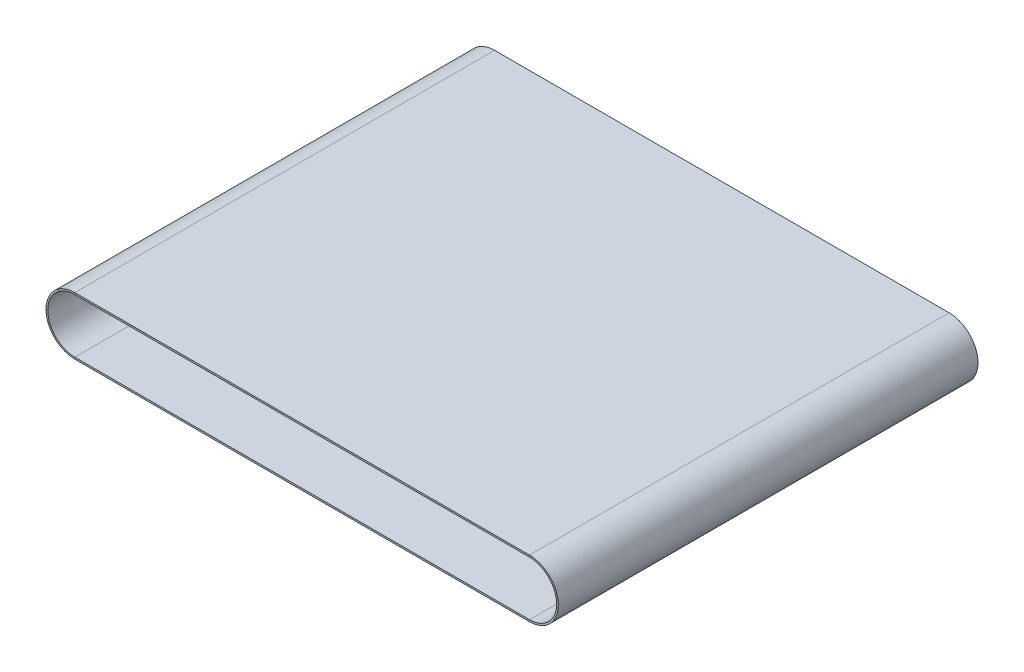
from build123d import *

# Parameters (mm, degrees)
SKETCH2_W = 240
SKETCH2_H = 1


with BuildPart() as part:
    # Sweep1: sweep along a path in Sketch1
    with BuildLine(Plane.XY) as sweep1_path:
        Line((-260, -15.5), (0, -15.5))
        ThreePointArc((0, -15.5), (15.5, 0), (0, 15.5))
        Line((0, 15.5), (-260, 15.5))
        ThreePointArc((-260, 15.5), (-275.5, 0), (-260, -15.5))
    # Sketch2 → Sweep1 (sweep)
    with BuildSketch(Plane(origin=(0, 0, 0), x_dir=(0, 0, -1), z_dir=(1, 0, 0))):
        with Locations((0, 16)):
            Rectangle(SKETCH2_W, SKETCH2_H)
    sweep(path=sweep1_path.line)


solid = part.part
